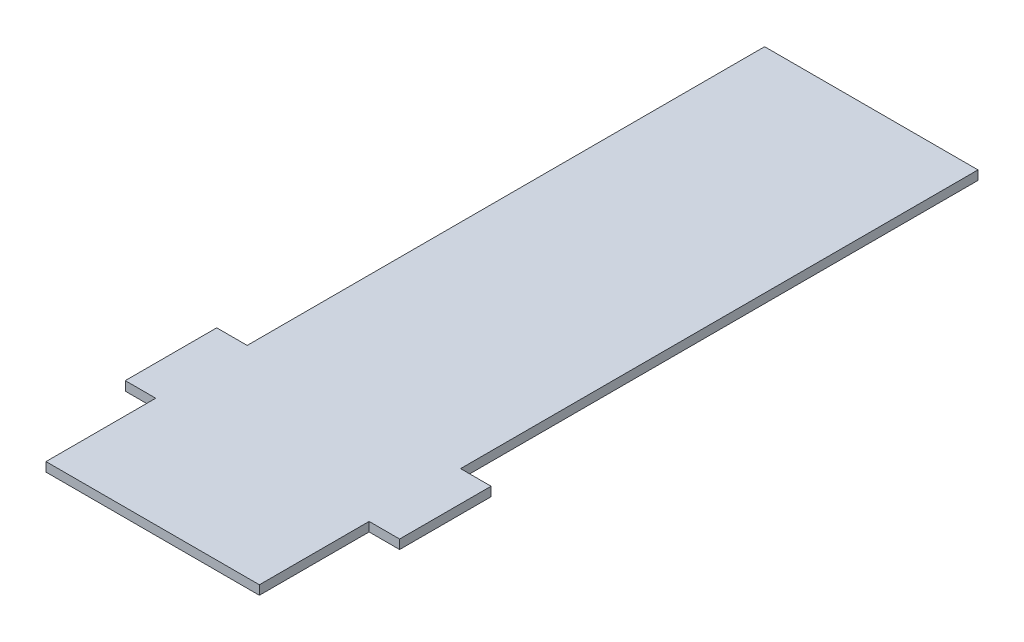
from build123d import *

# Parameters (mm, degrees)
BOSS_EXTRUDE5_DEPTH = 3


with BuildPart() as part:
    # Sketch5 → Boss-Extrude5 (new body)
    with BuildSketch(Plane(origin=(0, 0, 0), x_dir=(1, 0, 0), z_dir=(0, 1, 0))):
        Polygon((80, 66), (70, 66), (70, 235.74), (0, 235.74), (0, 66), (-10, 66), (-10, 36), (0, 36), (0, 0), (70, 0), (70, 36), (80, 36), align=None)
    extrude(amount=BOSS_EXTRUDE5_DEPTH)


solid = part.part
